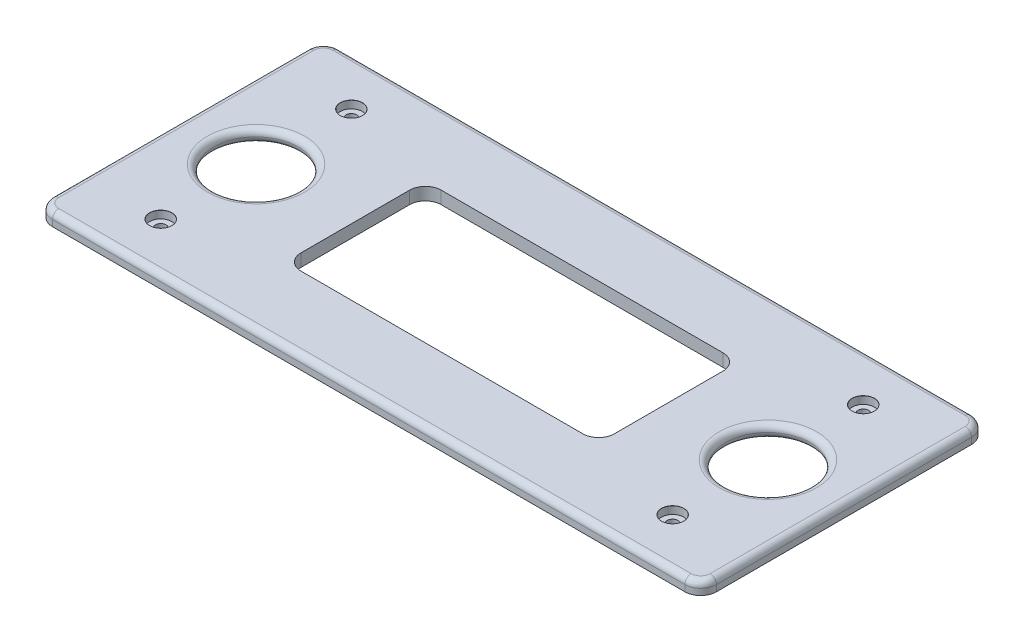
from build123d import *

# Parameters (mm, degrees)
SKETCH1_W                                     = 210.326
SKETCH1_H                                     = 90.8
BOSS_EXTRUDE1_DEPTH                           = 4
CBORE_FOR_M3_PAN_HEAD_MACHINE_SCREW1_AT_COUNT = 2
CBORE_FOR_M3_PAN_HEAD_MACHINE_SCREW1_AT_PITCH = 162.163
CBORE_FOR_M3_PAN_HEAD_MACHINE_SCREW1_2_COUNT  = 2
CBORE_FOR_M3_PAN_HEAD_MACHINE_SCREW1_2_PITCH  = 173.039043321
CBORE_FOR_M3_PAN_HEAD_MACHINE_SCREW1_3_COUNT  = 2
CBORE_FOR_M3_PAN_HEAD_MACHINE_SCREW1_3_PITCH  = 60.3794
SKETCH2_R                                     = 13.408
SKETCH2_W                                     = 99.282
SKETCH2_H                                     = 44.418
CUT_EXTRUDE1_DEPTH                            = 4
FILLET1_R                                     = 5
FILLET2_R                                     = 2


with BuildPart() as part:
    # Sketch1 → Boss-Extrude1 (new body)
    with BuildSketch(Plane(origin=(0, 0, 0), x_dir=(1, 0, 0), z_dir=(0, 1, 0))):
        Rectangle(SKETCH1_W, SKETCH1_H)
    extrude(amount=BOSS_EXTRUDE1_DEPTH)

    # Sketch5 → CBORE for M3 Pan Head Machine Screw1 (revolve, cut)
    with BuildSketch(Plane(origin=(-81.0815, 4, -30.1897), x_dir=(0, 0, 1), z_dir=(1, 0, 0))):
        Polygon((0, 0), (0, 4), (1.7, 4), (1.7, 2.4), (3.5, 2.4), (3.5, 0.025), (3.525, 0), align=None)
    cbore_for_m3_pan_head_machine_screw1 = revolve(axis=Axis((-81.0815, 10.35, -30.1897), (0, -1, 0)), mode=Mode.SUBTRACT)

    # CBORE for M3 Pan Head Machine Screw1 at: CBORE for M3 Pan Head Machine Screw1 ×2
    with Locations(*[(i * CBORE_FOR_M3_PAN_HEAD_MACHINE_SCREW1_AT_PITCH, 0, 0) for i in range(1, CBORE_FOR_M3_PAN_HEAD_MACHINE_SCREW1_AT_COUNT)]):
        add(cbore_for_m3_pan_head_machine_screw1, mode=Mode.SUBTRACT)

    # CBORE for M3 Pan Head Machine Screw1 2: CBORE for M3 Pan Head Machine Screw1 ×2
    with Locations(*[Vector(0.9371468825068064, 0, 0.3489351237805877) * (i * CBORE_FOR_M3_PAN_HEAD_MACHINE_SCREW1_2_PITCH) for i in range(1, CBORE_FOR_M3_PAN_HEAD_MACHINE_SCREW1_2_COUNT)]):
        add(cbore_for_m3_pan_head_machine_screw1, mode=Mode.SUBTRACT)

    # CBORE for M3 Pan Head Machine Screw1 3: CBORE for M3 Pan Head Machine Screw1 ×2
    with Locations(*[(0, 0, i * CBORE_FOR_M3_PAN_HEAD_MACHINE_SCREW1_3_PITCH) for i in range(1, CBORE_FOR_M3_PAN_HEAD_MACHINE_SCREW1_3_COUNT)]):
        add(cbore_for_m3_pan_head_machine_screw1, mode=Mode.SUBTRACT)

    # Sketch2 → Cut-Extrude1 (cut)
    with BuildSketch(Plane(origin=(0, 4, 0), x_dir=(1, 0, 0), z_dir=(0, 1, 0))):
        with Locations(Location((-81.0815, 0, 0), (0, 0, 270))):
            Circle(SKETCH2_R)
        with Locations(Location((81.0815, 0, 0), (0, 0, 270))):
            Circle(SKETCH2_R)
        Rectangle(SKETCH2_W, SKETCH2_H)
    extrude(amount=-CUT_EXTRUDE1_DEPTH, mode=Mode.SUBTRACT)

    # Fillet1
    fillet1_edges = [part.edges().sort_by_distance(p)[0] for p in [
        (49.641, 2, -22.209),
        (49.641, 2, 22.209),
        (-49.641, 2, 22.209),
        (-49.641, 2, -22.209),
        (105.163, 2, 45.4),
        (-105.163, 2, 45.4),
        (-105.163, 2, -45.4),
        (105.163, 2, -45.4),
    ]]
    fillet(fillet1_edges, radius=FILLET1_R)

    # Fillet2
    fillet2_edges = [part.edges().sort_by_distance(p)[0] for p in [
        (81.0815, 0, -13.408),
        (81.0815, 4, -13.408),
        (-81.0815, 0, -13.408),
        (-81.0815, 4, -13.408),
        (0, 4, -45.4),
        (105.163, 4, 0),
        (-105.163, 4, 0),
        (0, 4, 45.4),
        (-103.698533906, 4, -43.935533906),
        (-103.698533906, 4, 43.935533906),
        (103.698533906, 4, 43.935533906),
        (103.698533906, 4, -43.935533906),
    ]]
    fillet(fillet2_edges, radius=FILLET2_R - 0.0001)  # a hair under: the kernel refuses the full size


solid = part.part
